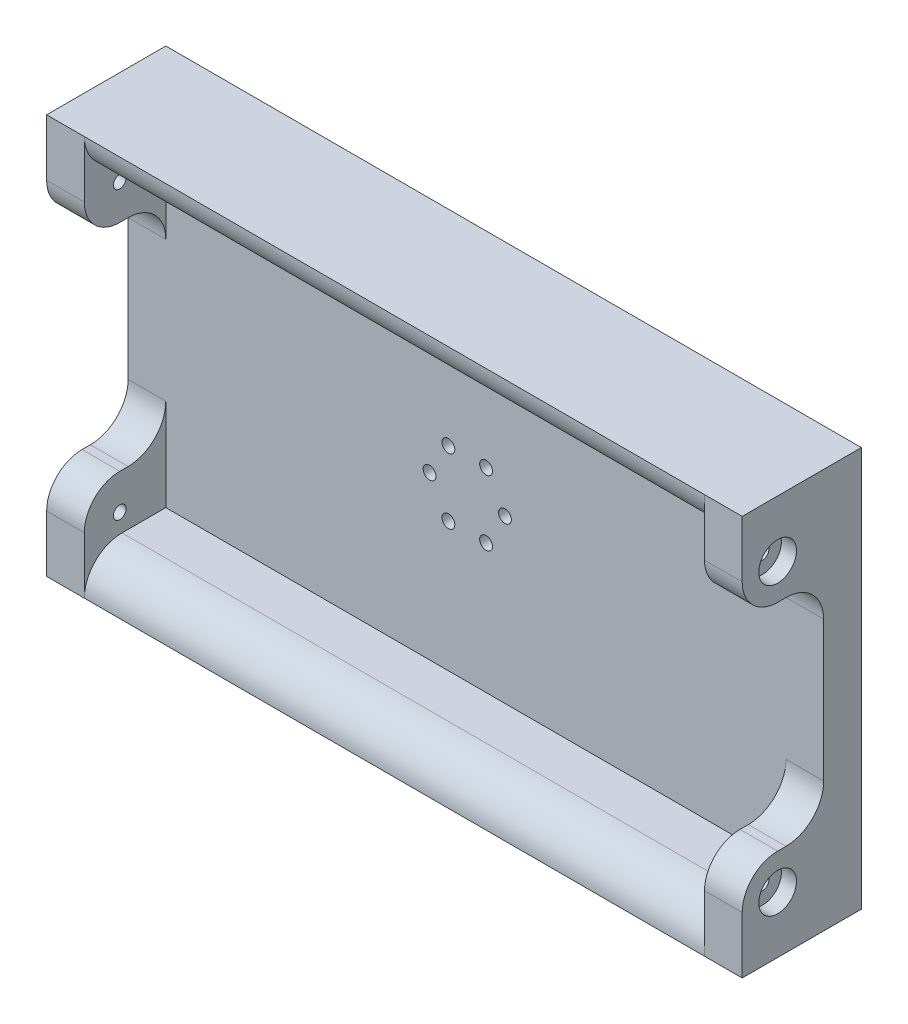
from build123d import *

# Parameters (mm, degrees)
SKETCH1_W             = 184.6
SKETCH1_H             = 106.1
BOSS_EXTRUDE1_DEPTH   = 10
CUT_EXTRUDE2_REACH    = 110.92
SKETCH7_R             = 1.7
SKETCH3_W             = 164.6
SKETCH3_H             = 10
BOSS_EXTRUDE2_DEPTH   = 21.625
FILLET1_R             = 10
SKETCH5_R             = 1.7
BOSS_EXTRUDE3_DEPTH   = 10
SKETCH6_R             = 5
CUT_EXTRUDE1_DEPTH    = 4
FILLET2_R             = 10
FILLET2_OF_MIRROR1_R  = 10
MIRROR2_START         = 84.6
MIRROR2_OUTLINE_R     = 5
MIRROR2_DEPTH         = 10
MIRROR2_2_OUTLINE_R   = 5
MIRROR2_2_OUTLINE_R_2 = 1.7
MIRROR2_2_DEPTH       = 6


# Read off the part's stored shape, not the designer's step: Mirror2
with BuildPart() as part:
    # Sketch1 → Boss-Extrude1 (new body)
    with BuildSketch(Plane.XY):
        with Locations((2.3, 0)):
            Rectangle(SKETCH1_W, SKETCH1_H)
    extrude(amount=BOSS_EXTRUDE1_DEPTH)

    # Sketch7 → Cut-Extrude2 (cut, up to next)
    with BuildSketch(Plane(origin=(0, 0, 0), x_dir=(-1, 0, 0), z_dir=(0, 0, -1)), mode=Mode.PRIVATE) as cut_extrude2_sk1:
        with Locations((-10, 0)):
            Circle(SKETCH7_R)
    cut_extrude2_tool1 = extrude(cut_extrude2_sk1.sketch, amount=-CUT_EXTRUDE2_REACH, mode=Mode.PRIVATE) & part.part
    # Sketch7 → Cut-Extrude2 (cut, up to next)
    with BuildSketch(Plane(origin=(0, 0, 0), x_dir=(-1, 0, 0), z_dir=(0, 0, -1)), mode=Mode.PRIVATE) as cut_extrude2_sk2:
        with Locations((-5, 8.660254038)):
            Circle(SKETCH7_R)
    cut_extrude2_tool2 = extrude(cut_extrude2_sk2.sketch, amount=-CUT_EXTRUDE2_REACH, mode=Mode.PRIVATE) & part.part
    # Sketch7 → Cut-Extrude2 (cut, up to next)
    with BuildSketch(Plane(origin=(0, 0, 0), x_dir=(-1, 0, 0), z_dir=(0, 0, -1)), mode=Mode.PRIVATE) as cut_extrude2_sk3:
        with Locations((5, 8.660254038)):
            Circle(SKETCH7_R)
    cut_extrude2_tool3 = extrude(cut_extrude2_sk3.sketch, amount=-CUT_EXTRUDE2_REACH, mode=Mode.PRIVATE) & part.part
    # Sketch7 → Cut-Extrude2 (cut, up to next)
    with BuildSketch(Plane(origin=(0, 0, 0), x_dir=(-1, 0, 0), z_dir=(0, 0, -1)), mode=Mode.PRIVATE) as cut_extrude2_sk4:
        with Locations((10, 0)):
            Circle(SKETCH7_R)
    cut_extrude2_tool4 = extrude(cut_extrude2_sk4.sketch, amount=-CUT_EXTRUDE2_REACH, mode=Mode.PRIVATE) & part.part
    # Sketch7 → Cut-Extrude2 (cut, up to next)
    with BuildSketch(Plane(origin=(0, 0, 0), x_dir=(-1, 0, 0), z_dir=(0, 0, -1)), mode=Mode.PRIVATE) as cut_extrude2_sk5:
        with Locations((5, -8.660254038)):
            Circle(SKETCH7_R)
    cut_extrude2_tool5 = extrude(cut_extrude2_sk5.sketch, amount=-CUT_EXTRUDE2_REACH, mode=Mode.PRIVATE) & part.part
    # Sketch7 → Cut-Extrude2 (cut, up to next)
    with BuildSketch(Plane(origin=(0, 0, 0), x_dir=(-1, 0, 0), z_dir=(0, 0, -1)), mode=Mode.PRIVATE) as cut_extrude2_sk6:
        with Locations((-5, -8.660254038)):
            Circle(SKETCH7_R)
    cut_extrude2_tool6 = extrude(cut_extrude2_sk6.sketch, amount=-CUT_EXTRUDE2_REACH, mode=Mode.PRIVATE) & part.part
    add(cut_extrude2_tool1.solids().sort_by_distance((10, 0, 0))[0], mode=Mode.SUBTRACT)
    add(cut_extrude2_tool2.solids().sort_by_distance((5, 8.660254, 0))[0], mode=Mode.SUBTRACT)
    add(cut_extrude2_tool3.solids().sort_by_distance((-5, 8.660254, 0))[0], mode=Mode.SUBTRACT)
    add(cut_extrude2_tool4.solids().sort_by_distance((-10, 0, 0))[0], mode=Mode.SUBTRACT)
    add(cut_extrude2_tool5.solids().sort_by_distance((-5, -8.660254, 0))[0], mode=Mode.SUBTRACT)
    add(cut_extrude2_tool6.solids().sort_by_distance((5, -8.660254, 0))[0], mode=Mode.SUBTRACT)

    # Sketch3 → Boss-Extrude2 (add)
    with BuildSketch(Plane.XY.offset(10)):
        with Locations((2.3, 48.05)):
            Rectangle(SKETCH3_W, SKETCH3_H)
        with Locations((2.3, -48.05)):
            Rectangle(SKETCH3_W, SKETCH3_H)
    extrude(amount=BOSS_EXTRUDE2_DEPTH)

    # Fillet1
    fillet1_edges = [part.edges().sort_by_distance(p)[0] for p in [
        (2.3, 43.05, 31.625),
        (2.3, -43.05, 31.625),
    ]]
    fillet(fillet1_edges, radius=FILLET1_R - 0.0001)  # a hair under: the kernel refuses the full size

    # Sketch5 → Boss-Extrude3 (add)
    with BuildSketch(Plane.ZY.offset(80)):
        with BuildLine():
            Line((31.625, 53.05), (31.625, 38))
            ThreePointArc((31.625, 38), (28.870383682, 31.349767926), (22.220151608, 28.595151608))
            Line((22.220151608, 28.595151608), (10, 28.595151608))
            Line((10, 28.595151608), (10, 53.05))
            Line((10, 53.05), (31.625, 53.05))
        make_face()
        with Locations(Location((22.220151608, 38, 0), (0, 0, 270))):
            Circle(SKETCH5_R, mode=Mode.SUBTRACT)
    boss_extrude3 = extrude(amount=BOSS_EXTRUDE3_DEPTH)

    # Sketch6 → Cut-Extrude1 (cut)
    with BuildSketch(Plane.ZY.offset(90)):
        with Locations((22.220151608, 38)):
            Circle(SKETCH6_R)
    cut_extrude1 = extrude(amount=-CUT_EXTRUDE1_DEPTH, mode=Mode.SUBTRACT)

    # Fillet2
    fillet2_edges = [part.edges().sort_by_distance(p)[0] for p in [
        (-85, 28.595151608, 10),
    ]]
    fillet(fillet2_edges, radius=FILLET2_R)

    # Mirror1: Boss-Extrude3, Cut-Extrude1 across plane
    add(boss_extrude3.mirror(Plane.ZX))
    add(cut_extrude1.mirror(Plane.ZX), mode=Mode.SUBTRACT)

    # Fillet2 of Mirror1
    fillet2_of_mirror1_edges = [part.edges().sort_by_distance(p)[0] for p in [
        (-85, -28.595151608, 10),
    ]]
    fillet(fillet2_of_mirror1_edges, radius=FILLET2_OF_MIRROR1_R)

    # Mirror2 outline → Mirror2 (add)
    # profile 1 of 2: a face of its own
    with BuildSketch(Plane.YZ.offset(MIRROR2_START)):
        with BuildLine():
            ThreePointArc((38, 31.625), (31.349767926, 28.870383682), (28.595151608, 22.220151608))
            Line((28.595151608, 22.220151608), (28.595151608, 20))
            ThreePointArc((28.595151608, 20), (25.66621942, 12.928932188), (18.595151608, 10))
            Line((18.595151608, 10), (53.05, 10))
            Line((53.05, 10), (53.05, 31.625))
            Line((53.05, 31.625), (38, 31.625))
        make_face()
        with Locations((38, 22.220151608)):
            Circle(MIRROR2_OUTLINE_R, mode=Mode.SUBTRACT)
    # profile 2 of 2: a face of its own
    with BuildSketch(Plane.YZ.offset(MIRROR2_START)):
        with BuildLine():
            Line((-53.05, 10), (-18.595151608, 10))
            ThreePointArc((-18.595151608, 10), (-25.66621942, 12.928932188), (-28.595151608, 20))
            Line((-28.595151608, 20), (-28.595151608, 22.220151608))
            ThreePointArc((-28.595151608, 22.220151608), (-31.349767926, 28.870383682), (-38, 31.625))
            Line((-38, 31.625), (-53.05, 31.625))
            Line((-53.05, 31.625), (-53.05, 10))
        make_face()
        with Locations((-38, 22.220151608)):
            Circle(MIRROR2_OUTLINE_R, mode=Mode.SUBTRACT)
    extrude(amount=MIRROR2_DEPTH)

    # Mirror2 2 outline → Mirror2 2 (add)
    # profile 1 of 2: a face of its own
    with BuildSketch(Plane.YZ.offset(MIRROR2_START)):
        with Locations((38, 22.220151608)):
            Circle(MIRROR2_2_OUTLINE_R)
        with Locations((38, 22.220151608)):
            Circle(MIRROR2_2_OUTLINE_R_2, mode=Mode.SUBTRACT)
    # profile 2 of 2: a face of its own
    with BuildSketch(Plane.YZ.offset(MIRROR2_START)):
        with Locations((-38, 22.220151608)):
            Circle(MIRROR2_2_OUTLINE_R)
        with Locations((-38, 22.220151608)):
            Circle(MIRROR2_2_OUTLINE_R_2, mode=Mode.SUBTRACT)
    extrude(amount=MIRROR2_2_DEPTH)


solid = part.part
